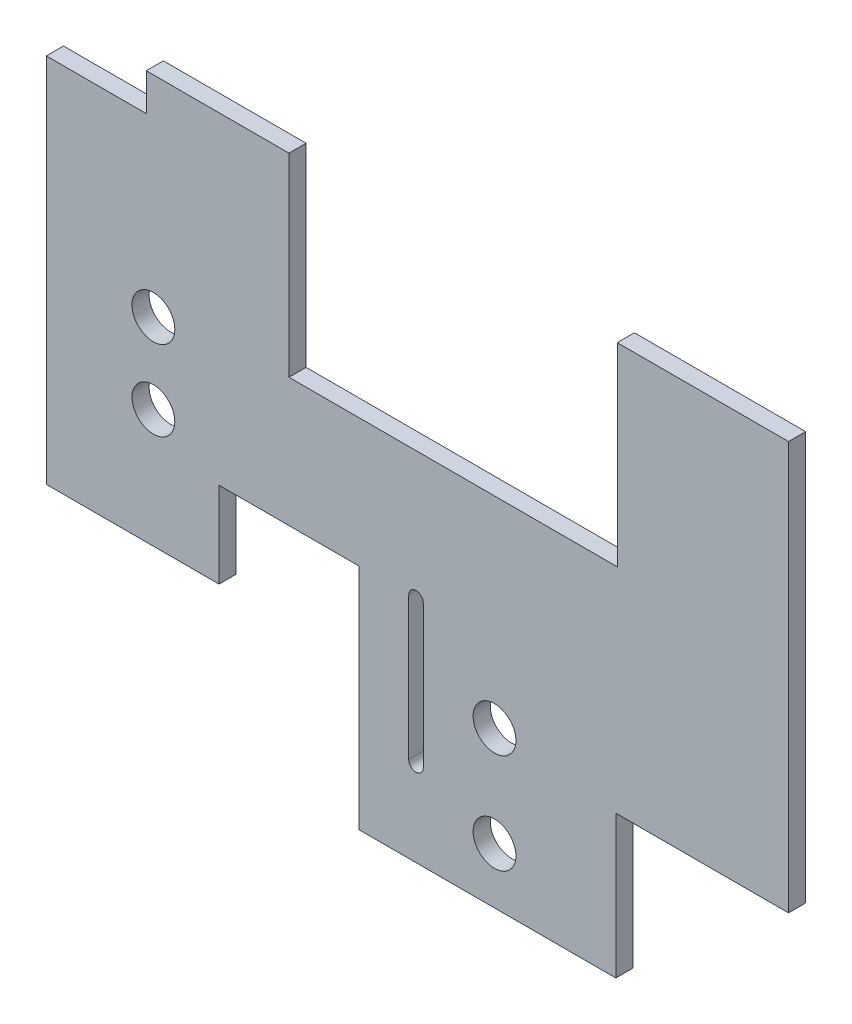
from build123d import *

# Parameters (mm, degrees)
ESBO_O1_R                = 7.5
RESSALTO_EXTRUS_O1_DEPTH = 6


with BuildPart() as part:
    # Esboço1 → Ressalto-extrusão1 (new body)
    with BuildSketch(Plane.XY):
        Polygon((-45, 28.5), (-45, 96.5), (-95, 96.5), (-95, 83.5), (-130, 83.5), (-130, -46.5), (-69.5, -46.5), (-69.5, -16.5), (-20.5, -16.5), (-20.5, -96.5), (69.5, -96.5), (69.5, -46.5), (130, -46.5), (130, 96.5), (70, 96.5), (70, 28.5), align=None)
        with Locations((-92.5, -5)):
            Circle(ESBO_O1_R, mode=Mode.SUBTRACT)
        with BuildLine():
            ThreePointArc((2.05, -66.5), (-0.5, -69.05), (-3.05, -66.5))
            Line((-3.05, -66.5), (-3.05, -16.5))
            ThreePointArc((-3.05, -16.5), (-0.5, -13.95), (2.05, -16.5))
            Line((2.05, -16.5), (2.05, -66.5))
        make_face(mode=Mode.SUBTRACT)
        with Locations((27, -77)):
            Circle(ESBO_O1_R, mode=Mode.SUBTRACT)
        with Locations((27, -42)):
            Circle(ESBO_O1_R, mode=Mode.SUBTRACT)
        with Locations((-92.5, 23)):
            Circle(ESBO_O1_R, mode=Mode.SUBTRACT)
    extrude(amount=RESSALTO_EXTRUS_O1_DEPTH)


solid = part.part
